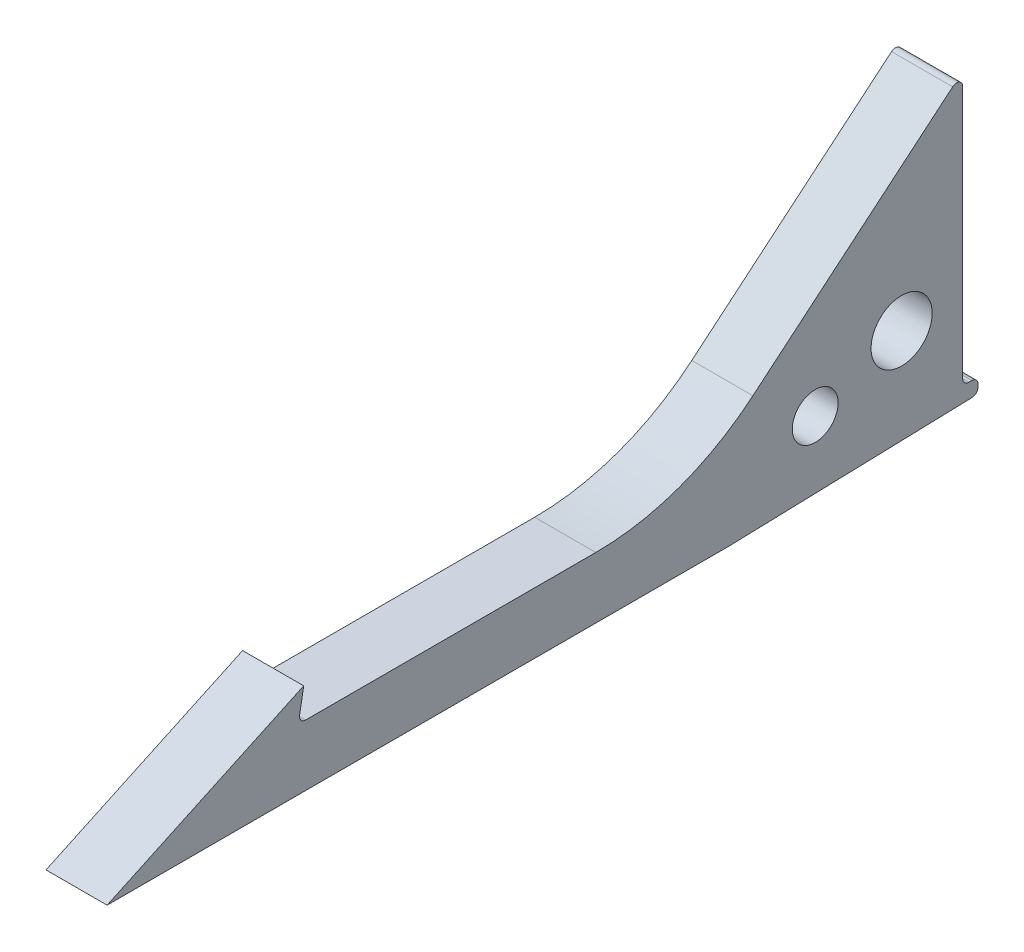
from build123d import *

# Parameters (mm, degrees)
STOCK_BEE_ZERKER_START                       = 34.925
STOCK_BEE_ZERKER_2_0_MULTIBODY_1_OUTLINE_R   = 2.38125
STOCK_BEE_ZERKER_2_0_MULTIBODY_1_OUTLINE_R_2 = 3.175
STOCK_BEE_ZERKER_2_0_MULTIBODY_1_DEPTH       = 6.35
FILLET1_R                                    = 0.635
FILLET2_R                                    = 25.4


# Read off the part's stored shape, not the designer's step: Stock-Bee-zerker 2.0 Multibody-1
with BuildPart() as part:
    # Stock-Bee-zerker 2.0 Multibody-1 outline → Stock-Bee-zerker 2.0 Multibody-1 (new body)
    with BuildSketch(Plane.YZ.offset(STOCK_BEE_ZERKER_START)):
        Polygon((9.525, 108.397291582), (0, 128.82372), (0, 64.1985), (0.762, 38.33622), (2.286, 38.33622), (2.286, 39.92372), (30.58384403, 39.92372), (6.35, 68.804490685), (6.35, 108.957129746), align=None)
        with Locations((7.233375897, 55.251985719)):
            Circle(STOCK_BEE_ZERKER_2_0_MULTIBODY_1_OUTLINE_R, mode=Mode.SUBTRACT)
        with Locations((10.414, 46.27372)):
            Circle(STOCK_BEE_ZERKER_2_0_MULTIBODY_1_OUTLINE_R_2, mode=Mode.SUBTRACT)
    extrude(amount=STOCK_BEE_ZERKER_2_0_MULTIBODY_1_DEPTH)

    # Fillet1
    fillet1_edges = [part.edges().sort_by_distance(p)[0] for p in [
        (38.1, 6.35, 108.957129746),
        (38.1, 30.58384403, 39.92372),
        (38.1, 2.286, 39.92372),
        (38.1, 2.286, 38.33622),
        (38.1, 0.762, 38.33622),
    ]]
    fillet(fillet1_edges, radius=FILLET1_R)

    # Fillet2
    # the kernel refuses this fillet: 25.4 mm, written as the material it adds along each edge
    with BuildSketch(Plane(origin=(34.925, 6.35, 68.804490685), x_dir=(0, 0, 1), z_dir=(1, 0, 0))) as fillet2_piece_1:
        with BuildLine():
            CenterArc((FILLET2_R * 0.363970234267, -FILLET2_R), FILLET2_R, 90, 40)
            Line((-FILLET2_R * 0.278817375421, -FILLET2_R * 0.233955556882), (0, 0))
            Line((0, 0), (FILLET2_R * 0.363970234267, 0))
        make_face()
    extrude(amount=6.35)
    # the kernel refuses this fillet: 25.4 mm, written as the material it takes off along each edge
    with BuildSketch(Plane(origin=(33.98972857, 0, 64.1985), x_dir=(0, 0.029450978958150506, -0.9995662258391919), z_dir=(1, 0, 0))) as fillet2_2_piece_1:
        with BuildLine():
            CenterArc((FILLET2_R * 0.0147286839403, FILLET2_R), FILLET2_R, 268.312339175, 1.687660825)
            Line((-FILLET2_R * 0.0147222950178, FILLET2_R * 0.000433774160808), (0, 0))
            Line((0, 0), (FILLET2_R * 0.0147286839403, 0))
        make_face()
    extrude(amount=8.22054286, mode=Mode.SUBTRACT)


solid = part.part
